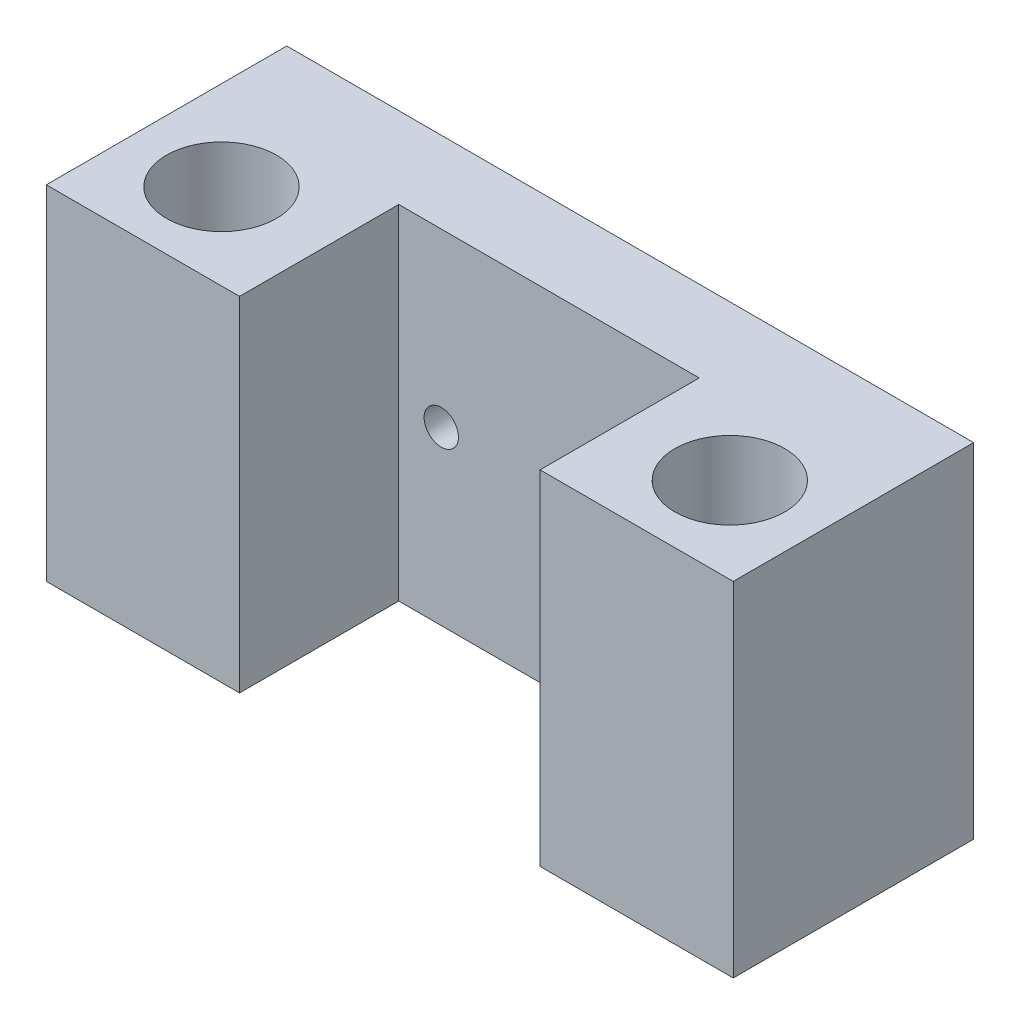
from build123d import *

# Parameters (mm, degrees)
SKETCH3_W           = 100
SKETCH3_H           = 50
BOSS_EXTRUDE1_DEPTH = 25
SKETCH5_R           = 8
SKETCH5_W           = 43.746020772
SKETCH5_H           = 23.175190528
CUT_EXTRUDE1_DEPTH  = 76
SKETCH7_R           = 2.5
CUT_EXTRUDE4_DEPTH  = 10
BOSS_EXTRUDE2_START = 10
SKETCH8_W           = 100
SKETCH8_H           = 50
SKETCH8_R           = 2.5
BOSS_EXTRUDE2_DEPTH = 10
SKETCH9_R           = 2.5
CUT_EXTRUDE5_DEPTH  = 61.515200248


with BuildPart() as part:
    # Sketch3 → Boss-Extrude1 (new body)
    with BuildSketch(Plane.XY):
        Rectangle(SKETCH3_W, SKETCH3_H)
    extrude(amount=BOSS_EXTRUDE1_DEPTH)

    # Sketch5 → Cut-Extrude1 (cut, through all)
    with BuildSketch(Plane(origin=(0, 25, 0), x_dir=(1, 0, 0), z_dir=(0, 1, 0))):
        with Locations((37, -12.5)):
            Circle(SKETCH5_R)
        with Locations((-37, -12.5)):
            Circle(SKETCH5_R)
        with Locations((0, -13.412404736)):
            Rectangle(SKETCH5_W, SKETCH5_H)
    extrude(amount=-CUT_EXTRUDE1_DEPTH, mode=Mode.SUBTRACT)

    # Sketch7 → Cut-Extrude4 (cut)
    with BuildSketch(Plane(origin=(0, 0, 0), x_dir=(-1, 0, 0), z_dir=(0, 0, -1))):
        with Locations((32.5, 9.25)):
            Circle(SKETCH7_R)
        with Locations((32.5, -9.25)):
            Circle(SKETCH7_R)
        with Locations((-32.5, -9.25)):
            Circle(SKETCH7_R)
        with Locations((-32.5, 9.25)):
            Circle(SKETCH7_R)
    extrude(amount=-CUT_EXTRUDE4_DEPTH, mode=Mode.SUBTRACT)

    # Sketch8 → Boss-Extrude2 (add)
    with BuildSketch(Plane(origin=(0, 0, 0), x_dir=(-1, 0, 0), z_dir=(0, 0, -1)).offset(BOSS_EXTRUDE2_START)):
        Rectangle(SKETCH8_W, SKETCH8_H)
        with Locations((-32.5, 9.25)):
            Circle(SKETCH8_R, mode=Mode.SUBTRACT)
        with Locations((-32.5, -9.25)):
            Circle(SKETCH8_R, mode=Mode.SUBTRACT)
        with Locations((32.5, -9.25)):
            Circle(SKETCH8_R, mode=Mode.SUBTRACT)
        with Locations((32.5, 9.25)):
            Circle(SKETCH8_R, mode=Mode.SUBTRACT)
    extrude(amount=-BOSS_EXTRUDE2_DEPTH)

    # Sketch9 → Cut-Extrude5 (cut, through all)
    with BuildSketch(Plane.XY.offset(1.824809472)):
        with Locations((-15.68, 0)):
            Circle(SKETCH9_R)
        with Locations((15.68, 0)):
            Circle(SKETCH9_R)
    extrude(amount=-CUT_EXTRUDE5_DEPTH, mode=Mode.SUBTRACT)


solid = part.part
